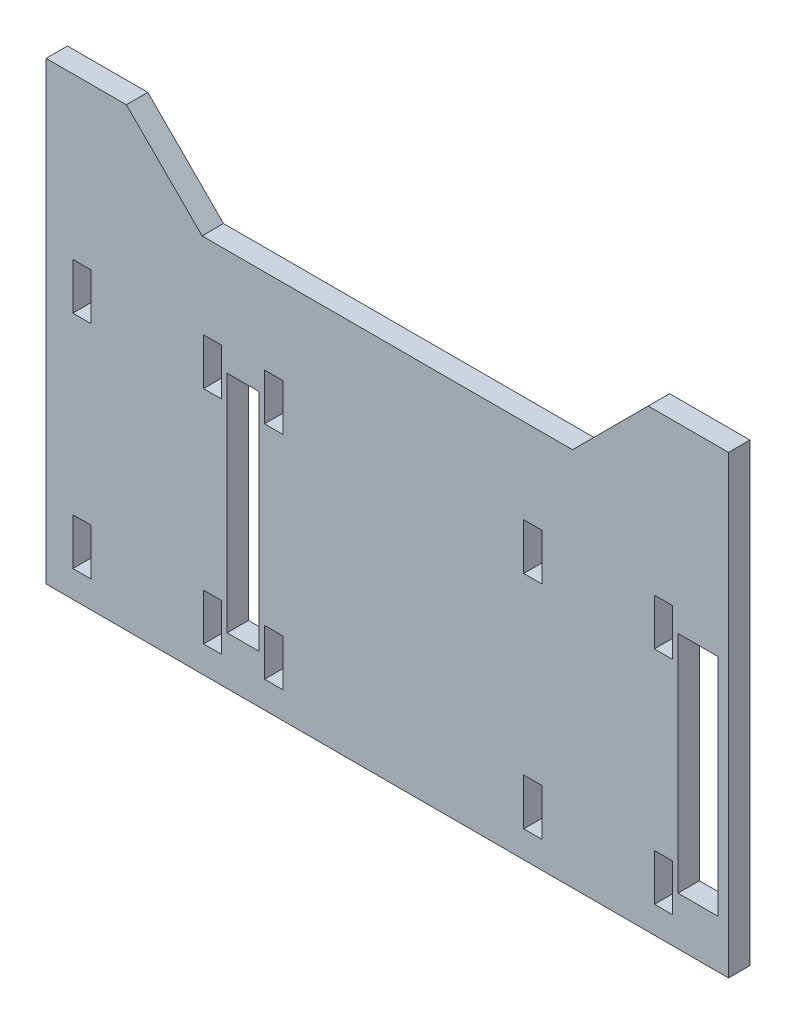
from build123d import *

# Parameters (mm, degrees)
SKETCH1_W           = 3.4
SKETCH1_H           = 8.7
SKETCH1_W_2         = 7.5
SKETCH1_H_2         = 42
SKETCH1_W_3         = 6
BOSS_EXTRUDE1_DEPTH = 4
BOSS_EXTRUDE2_DEPTH = 4


with BuildPart() as part:
    # Sketch1 → Boss-Extrude1 (new body)
    with BuildSketch(Plane.XY):
        Polygon((-66.7, 30), (-66.7, -30), (55.3, -30), (60.740194605, -30), (60.740194605, 30), (55.3, 30), align=None)
        with Locations((-35.6, 20.65)):
            Rectangle(SKETCH1_W, SKETCH1_H, mode=Mode.SUBTRACT)
        with Locations((24.2, 20.65)):
            Rectangle(SKETCH1_W, SKETCH1_H, mode=Mode.SUBTRACT)
        with Locations((24.2, -20.65)):
            Rectangle(SKETCH1_W, SKETCH1_H, mode=Mode.SUBTRACT)
        with Locations((-24.2, 20.65)):
            Rectangle(SKETCH1_W, SKETCH1_H, mode=Mode.SUBTRACT)
        with Locations((-24.2, -20.65)):
            Rectangle(SKETCH1_W, SKETCH1_H, mode=Mode.SUBTRACT)
        with Locations((48.6, 20.65)):
            Rectangle(SKETCH1_W, SKETCH1_H, mode=Mode.SUBTRACT)
        with Locations((48.6, -20.65)):
            Rectangle(SKETCH1_W, SKETCH1_H, mode=Mode.SUBTRACT)
        with Locations((-35.6, -20.65)):
            Rectangle(SKETCH1_W, SKETCH1_H, mode=Mode.SUBTRACT)
        with Locations((-60, 20.65)):
            Rectangle(SKETCH1_W, SKETCH1_H, mode=Mode.SUBTRACT)
        with Locations((-60, -20.65)):
            Rectangle(SKETCH1_W, SKETCH1_H, mode=Mode.SUBTRACT)
        with Locations((55.05, 0)):
            Rectangle(SKETCH1_W_2, SKETCH1_H_2, mode=Mode.SUBTRACT)
        with Locations((-29.9, 0)):
            Rectangle(SKETCH1_W_3, SKETCH1_H_2, mode=Mode.SUBTRACT)
    extrude(amount=BOSS_EXTRUDE1_DEPTH)

    # Sketch2 → Boss-Extrude2 (add)
    with BuildSketch(Plane.XY):
        Polygon((-66.7, 30), (-66.7, 55), (-51.7, 55), (-37.557864376, 40.857864376), (31.598058981, 40.857864376), (45.740194605, 55), (60.740194605, 55), (60.740194605, 30), align=None)
    extrude(amount=BOSS_EXTRUDE2_DEPTH)


solid = part.part
